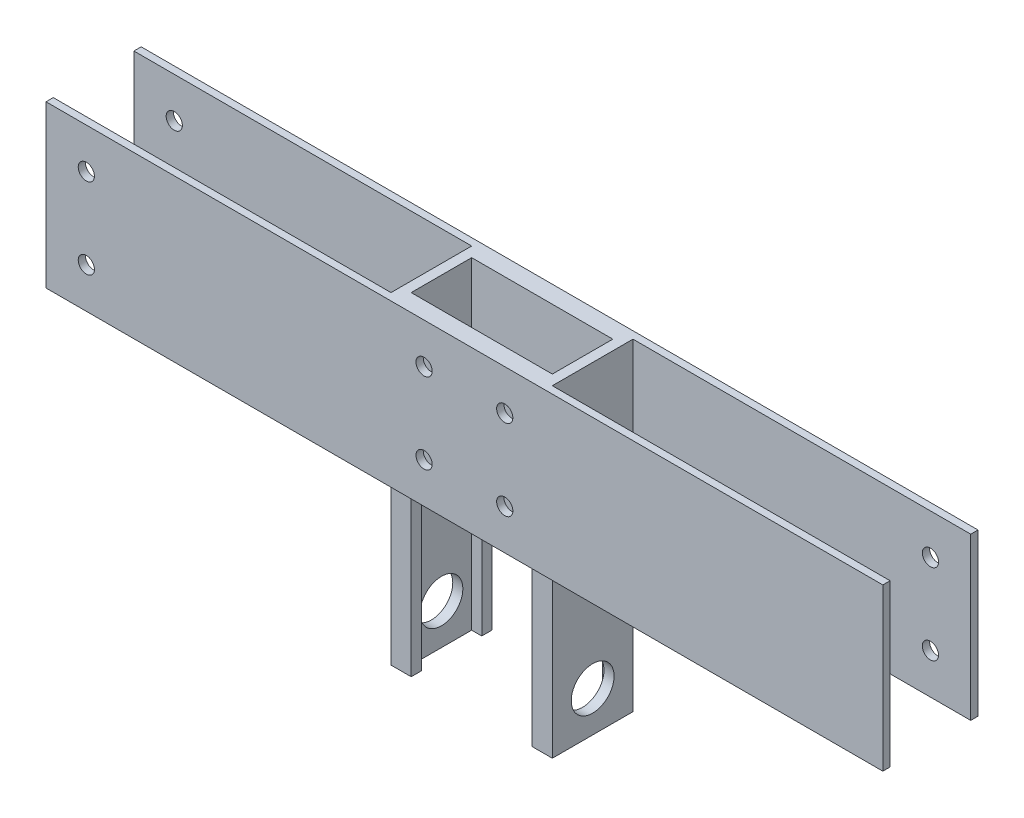
from build123d import *

# Parameters (mm, degrees)
SKETCH1_W                       = 263.525
SKETCH1_H                       = 50.8
BOSS_EXTRUDE1_DEPTH             = 1.143
SKETCH2_W                       = 2.5527
SKETCH2_H                       = 2.286
F_10_CLEARANCE_HOLE1_AT_2_COUNT = 2
F_10_CLEARANCE_HOLE1_AT_2_PITCH = 25.4
F_10_CLEARANCE_HOLE1_AT_3_COUNT = 2
F_10_CLEARANCE_HOLE1_AT_3_PITCH = 106.3625
F_10_CLEARANCE_HOLE1_AT_4_COUNT = 2
F_10_CLEARANCE_HOLE1_AT_4_PITCH = 109.353287131
F_10_CLEARANCE_HOLE1_AT_5_COUNT = 2
F_10_CLEARANCE_HOLE1_AT_5_PITCH = 134.188361665
F_10_CLEARANCE_HOLE1_AT_6_COUNT = 2
F_10_CLEARANCE_HOLE1_AT_6_PITCH = 131.7625
MIRROR1_COPY_1_SKETCH_W         = 2.5527
MIRROR1_COPY_1_SKETCH_H         = 2.286
MIRROR1_COPY_2_SKETCH_W         = 2.5527
MIRROR1_COPY_2_SKETCH_H         = 2.286
MIRROR1_COPY_3_SKETCH_W         = 2.5527
MIRROR1_COPY_3_SKETCH_H         = 2.286
MIRROR1_COPY_4_SKETCH_W         = 2.5527
MIRROR1_COPY_4_SKETCH_H         = 2.286
MIRROR1_COPY_5_SKETCH_W         = 2.5527
MIRROR1_COPY_5_SKETCH_H         = 2.286
BOSS_EXTRUDE2_DEPTH             = 25.4
BOSS_EXTRUDE2_DEPTH_BACK        = 76.2
SKETCH4_W                       = 50.8
SKETCH4_H                       = 25.4
SKETCH4_W_2                     = 44.45
SKETCH4_H_2                     = 19.05
MIRROR2_COPY_1_SKETCH_W         = 2.5527
MIRROR2_COPY_1_SKETCH_H         = 2.286
MIRROR2_COPY_2_SKETCH_W         = 2.5527
MIRROR2_COPY_2_SKETCH_H         = 2.286
MIRROR2_COPY_3_SKETCH_W         = 2.5527
MIRROR2_COPY_3_SKETCH_H         = 2.286
MIRROR2_COPY_4_SKETCH_W         = 2.5527
MIRROR2_COPY_4_SKETCH_H         = 2.286
MIRROR2_COPY_5_SKETCH_W         = 2.5527
MIRROR2_COPY_5_SKETCH_H         = 2.286
SKETCH5_W                       = 38.1
SKETCH5_H                       = 50.8
CUT_EXTRUDE1_DEPTH              = 155.707178251
F_1_2_CLEARANCE_HOLE1_D         = 13.49248


with BuildPart() as part:
    # Sketch1 → Boss-Extrude1 (new, symmetric)
    with BuildSketch(Plane.XY):
        Rectangle(SKETCH1_W, SKETCH1_H)
    boss_extrude1 = extrude(amount=BOSS_EXTRUDE1_DEPTH, both=True)

    # Sketch2 → #10 Clearance Hole1 (revolve, cut)
    with BuildSketch(Plane(origin=(-119.0625, 12.7, 1.143), x_dir=(0, -1, 0), z_dir=(1, 0, 0))):
        with Locations((1.27635, 1.143)):
            Rectangle(SKETCH2_W, SKETCH2_H)
    f_10_clearance_hole1 = revolve(axis=Axis((-119.0625, 12.7, 7.493), (0, 0, -1)), mode=Mode.SUBTRACT)

    # #10 Clearance Hole1 at 2: #10 Clearance Hole1 ×2
    with Locations(*[(0, -i * F_10_CLEARANCE_HOLE1_AT_2_PITCH, 0) for i in range(1, F_10_CLEARANCE_HOLE1_AT_2_COUNT)]):
        add(f_10_clearance_hole1, mode=Mode.SUBTRACT)

    # #10 Clearance Hole1 at 3: #10 Clearance Hole1 ×2
    with Locations(*[(i * F_10_CLEARANCE_HOLE1_AT_3_PITCH, 0, 0) for i in range(1, F_10_CLEARANCE_HOLE1_AT_3_COUNT)]):
        add(f_10_clearance_hole1, mode=Mode.SUBTRACT)

    # #10 Clearance Hole1 at 4: #10 Clearance Hole1 ×2
    with Locations(*[Vector(0.9726502311087317, -0.2322746820558168, 0) * (i * F_10_CLEARANCE_HOLE1_AT_4_PITCH) for i in range(1, F_10_CLEARANCE_HOLE1_AT_4_COUNT)]):
        add(f_10_clearance_hole1, mode=Mode.SUBTRACT)

    # #10 Clearance Hole1 at 5: #10 Clearance Hole1 ×2
    with Locations(*[Vector(0.9819219667444901, -0.18928616226399833, 0) * (i * F_10_CLEARANCE_HOLE1_AT_5_PITCH) for i in range(1, F_10_CLEARANCE_HOLE1_AT_5_COUNT)]):
        add(f_10_clearance_hole1, mode=Mode.SUBTRACT)

    # #10 Clearance Hole1 at 6: #10 Clearance Hole1 ×2
    with Locations(*[(i * F_10_CLEARANCE_HOLE1_AT_6_PITCH, 0, 0) for i in range(1, F_10_CLEARANCE_HOLE1_AT_6_COUNT)]):
        add(f_10_clearance_hole1, mode=Mode.SUBTRACT)

    # Mirror1: #10 Clearance Hole1 across plane
    add(f_10_clearance_hole1.mirror(Plane(origin=(0, 0, 0), x_dir=(0, 0, 1), z_dir=(1, 0, 0))), mode=Mode.SUBTRACT)

    # Mirror1 copy 1 sketch → Mirror1 copy 1 (revolve, cut)
    with BuildSketch(Plane(origin=(119.0625, -12.7, 1.143), x_dir=(0, -1, 0), z_dir=(-1, 0, 0))):
        with Locations((1.27635, -1.143)):
            Rectangle(MIRROR1_COPY_1_SKETCH_W, MIRROR1_COPY_1_SKETCH_H)
    revolve(axis=Axis((119.0625, -12.7, 7.493), (0, 0, 1)), mode=Mode.SUBTRACT)

    # Mirror1 copy 2 sketch → Mirror1 copy 2 (revolve, cut)
    with BuildSketch(Plane(origin=(12.7, 12.7, 1.143), x_dir=(0, -1, 0), z_dir=(-1, 0, 0))):
        with Locations((1.27635, -1.143)):
            Rectangle(MIRROR1_COPY_2_SKETCH_W, MIRROR1_COPY_2_SKETCH_H)
    revolve(axis=Axis((12.7, 12.7, 7.493), (0, 0, 1)), mode=Mode.SUBTRACT)

    # Mirror1 copy 3 sketch → Mirror1 copy 3 (revolve, cut)
    with BuildSketch(Plane(origin=(12.7, -12.7, 1.143), x_dir=(0, -1, 0), z_dir=(-1, 0, 0))):
        with Locations((1.27635, -1.143)):
            Rectangle(MIRROR1_COPY_3_SKETCH_W, MIRROR1_COPY_3_SKETCH_H)
    revolve(axis=Axis((12.7, -12.7, 7.493), (0, 0, 1)), mode=Mode.SUBTRACT)

    # Mirror1 copy 4 sketch → Mirror1 copy 4 (revolve, cut)
    with BuildSketch(Plane(origin=(-12.7, -12.7, 1.143), x_dir=(0, -1, 0), z_dir=(-1, 0, 0))):
        with Locations((1.27635, -1.143)):
            Rectangle(MIRROR1_COPY_4_SKETCH_W, MIRROR1_COPY_4_SKETCH_H)
    revolve(axis=Axis((-12.7, -12.7, 7.493), (0, 0, 1)), mode=Mode.SUBTRACT)

    # Mirror1 copy 5 sketch → Mirror1 copy 5 (revolve, cut)
    with BuildSketch(Plane(origin=(-12.7, 12.7, 1.143), x_dir=(0, -1, 0), z_dir=(-1, 0, 0))):
        with Locations((1.27635, -1.143)):
            Rectangle(MIRROR1_COPY_5_SKETCH_W, MIRROR1_COPY_5_SKETCH_H)
    revolve(axis=Axis((-12.7, 12.7, 7.493), (0, 0, 1)), mode=Mode.SUBTRACT)

    # Sketch4 → Boss-Extrude2 (add, two sides: drawn at the far end of the back side and taken through both)
    with BuildSketch(Plane(origin=(0, 0, 0), x_dir=(1, 0, 0), z_dir=(0, 1, 0)).offset(-BOSS_EXTRUDE2_DEPTH_BACK)):
        with Locations((0, -13.843)):
            Rectangle(SKETCH4_W, SKETCH4_H)
        with Locations((0, -13.843)):
            Rectangle(SKETCH4_W_2, SKETCH4_H_2, mode=Mode.SUBTRACT)
    extrude(amount=BOSS_EXTRUDE2_DEPTH + BOSS_EXTRUDE2_DEPTH_BACK)

    # Mirror2: Boss-Extrude1, #10 Clearance Hole1 across plane
    add(boss_extrude1.mirror(Plane.XY.offset(13.843)))
    add(f_10_clearance_hole1.mirror(Plane.XY.offset(13.843)), mode=Mode.SUBTRACT)

    # Mirror2 copy 1 sketch → Mirror2 copy 1 (revolve, cut)
    with BuildSketch(Plane(origin=(-119.0625, -12.7, 26.543), x_dir=(0, -1, 0), z_dir=(1, 0, 0))):
        with Locations((1.27635, -1.143)):
            Rectangle(MIRROR2_COPY_1_SKETCH_W, MIRROR2_COPY_1_SKETCH_H)
    revolve(axis=Axis((-119.0625, -12.7, 20.193), (0, 0, -1)), mode=Mode.SUBTRACT)

    # Mirror2 copy 2 sketch → Mirror2 copy 2 (revolve, cut)
    with BuildSketch(Plane(origin=(-12.7, 12.7, 26.543), x_dir=(0, -1, 0), z_dir=(1, 0, 0))):
        with Locations((1.27635, -1.143)):
            Rectangle(MIRROR2_COPY_2_SKETCH_W, MIRROR2_COPY_2_SKETCH_H)
    revolve(axis=Axis((-12.7, 12.7, 20.193), (0, 0, -1)), mode=Mode.SUBTRACT)

    # Mirror2 copy 3 sketch → Mirror2 copy 3 (revolve, cut)
    with BuildSketch(Plane(origin=(-12.7, -12.7, 26.543), x_dir=(0, -1, 0), z_dir=(1, 0, 0))):
        with Locations((1.27635, -1.143)):
            Rectangle(MIRROR2_COPY_3_SKETCH_W, MIRROR2_COPY_3_SKETCH_H)
    revolve(axis=Axis((-12.7, -12.7, 20.193), (0, 0, -1)), mode=Mode.SUBTRACT)

    # Mirror2 copy 4 sketch → Mirror2 copy 4 (revolve, cut)
    with BuildSketch(Plane(origin=(12.7, -12.7, 26.543), x_dir=(0, -1, 0), z_dir=(1, 0, 0))):
        with Locations((1.27635, -1.143)):
            Rectangle(MIRROR2_COPY_4_SKETCH_W, MIRROR2_COPY_4_SKETCH_H)
    revolve(axis=Axis((12.7, -12.7, 20.193), (0, 0, -1)), mode=Mode.SUBTRACT)

    # Mirror2 copy 5 sketch → Mirror2 copy 5 (revolve, cut)
    with BuildSketch(Plane(origin=(12.7, 12.7, 26.543), x_dir=(0, -1, 0), z_dir=(1, 0, 0))):
        with Locations((1.27635, -1.143)):
            Rectangle(MIRROR2_COPY_5_SKETCH_W, MIRROR2_COPY_5_SKETCH_H)
    revolve(axis=Axis((12.7, 12.7, 20.193), (0, 0, -1)), mode=Mode.SUBTRACT)

    # Sketch5 → Cut-Extrude1 (cut, through all)
    with BuildSketch(Plane.XY.offset(26.543)):
        with Locations((0, -50.8)):
            Rectangle(SKETCH5_W, SKETCH5_H)
    extrude(amount=-CUT_EXTRUDE1_DEPTH, mode=Mode.SUBTRACT)

    # 1/2 Clearance Hole1 (through all)
    with Locations(Plane(origin=(25.4, 0, 0), x_dir=(0, 0, -1), z_dir=(1, 0, 0))):
        with Locations((-13.843, -63.5)):
            Hole(F_1_2_CLEARANCE_HOLE1_D / 2)


solid = part.part
